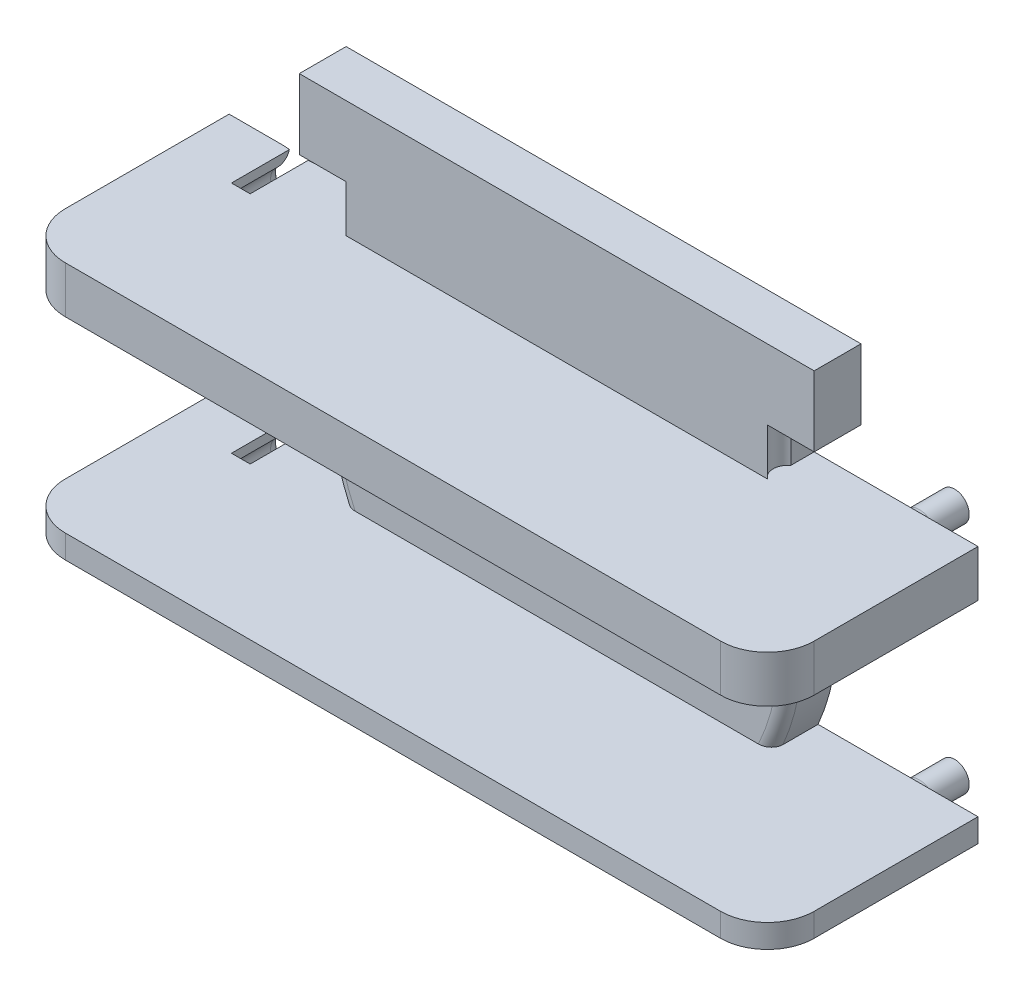
from build123d import *

# Parameters (mm, degrees)
BOSS_EXTRUDE1_DEPTH     = 2
SKETCH2_R               = 1.575
BOSS_EXTRUDE2_DEPTH     = 4
SKETCH3_R               = 1.8
BOSS_EXTRUDE3_DEPTH     = 0.75
SKETCH4_W               = 2
SKETCH4_H               = 17
BOSS_EXTRUDE4_DEPTH     = 0.001
SKETCH5_W               = 18
SKETCH5_H               = 2
BOSS_EXTRUDE5_DEPTH     = 0.001
SKETCH6_W               = 2.001
SKETCH6_H               = 2
BOSS_EXTRUDE6_DEPTH     = 5
BOSS_EXTRUDE7_DEPTH     = 0.001
CUT_EXTRUDE1_DEPTH      = 20.519323784
SKETCH9_W               = 2.937742252
SKETCH9_H               = 8
CUT_EXTRUDE2_DEPTH      = 0.001
CUT_EXTRUDE11_START     = -0.001
SKETCH21_R              = 9.75
SKETCH21_R_2            = 1.8
CUT_EXTRUDE11_DEPTH     = 0.001
SKETCH10_W              = 32
SKETCH10_H              = 2
BOSS_EXTRUDE8_DEPTH     = 7
FILLET1_R               = 0.5
SKETCH11_R              = 0.625
BOSS_EXTRUDE9_DEPTH     = 2
SKETCH14_W              = 2
SKETCH14_H              = 2
CUT_EXTRUDE5_DEPTH      = 22.401355237
SKETCH12_R              = 0.725
CUT_EXTRUDE3_DEPTH      = 2.5
CUT_EXTRUDE6_DEPTH      = 2
FILLET2_R               = 0.5
FILLET3_R               = 0.5
FILLET4_R               = 2
CUT_EXTRUDE7_DEPTH      = 26.019992106
CUT_EXTRUDE7_DEPTH_BACK = 1
CUT_EXTRUDE12_REACH     = 23.401


with BuildPart() as part:
    # Sketch1 → Boss-Extrude1 (new body)
    with BuildSketch(Plane.XY):
        Polygon((-11, 6), (-11, 11), (11, 11), (11, 6), (11, -6), (-11, -6), align=None)
    extrude(amount=BOSS_EXTRUDE1_DEPTH)

    # Sketch3 → Boss-Extrude3 (add)
    with BuildSketch(Plane(origin=(0, 0, 0), x_dir=(-1, 0, 0), z_dir=(0, 0, -1))):
        with Locations(Location((0, 0, 0), (0, 0, 180))):
            Circle(SKETCH3_R)
    extrude(amount=BOSS_EXTRUDE3_DEPTH)

    # Sketch4 → Boss-Extrude4 (add)
    with BuildSketch(Plane(origin=(0, 0, 0), x_dir=(-1, 0, 0), z_dir=(0, 0, -1))):
        with Locations((10, 2.5)):
            Rectangle(SKETCH4_W, SKETCH4_H)
        with Locations((-10, 2.5)):
            Rectangle(SKETCH4_W, SKETCH4_H)
    extrude(amount=BOSS_EXTRUDE4_DEPTH)

    # Sketch5 → Boss-Extrude5 (add)
    with BuildSketch(Plane(origin=(0, 0, 0), x_dir=(-1, 0, 0), z_dir=(0, 0, -1))):
        with Locations((0, 10)):
            Rectangle(SKETCH5_W, SKETCH5_H)
    extrude(amount=BOSS_EXTRUDE5_DEPTH)

    # Sketch6 → Boss-Extrude6 (add)
    with BuildSketch(Plane(origin=(11, 0, 0), x_dir=(0, 0, -1), z_dir=(1, 0, 0))):
        with Locations((-0.9995, -5)):
            Rectangle(SKETCH6_W, SKETCH6_H)
        with Locations((-0.9995, 5)):
            Rectangle(SKETCH6_W, SKETCH6_H)
    boss_extrude6 = extrude(amount=BOSS_EXTRUDE6_DEPTH)

    # Mirror1: Boss-Extrude6 across plane
    add(boss_extrude6.mirror(Plane(origin=(0, 0, 0), x_dir=(0, 0, 1), z_dir=(1, 0, 0))))

    # Sketch7 → Boss-Extrude7 (add)
    with BuildSketch(Plane(origin=(0, 0, -0.001), x_dir=(-1, 0, 0), z_dir=(0, 0, -1))):
        with BuildLine():
            ThreePointArc((-6.708203932, -6), (-8.407551231, -3.211398808), (-9, 0))
            Line((-9, 0), (-9, -6))
            Line((-9, -6), (-6.708203932, -6))
        make_face()
        with BuildLine():
            Line((-9, 9), (-9, 0))
            ThreePointArc((-9, 0), (-6.363961031, 6.363961031), (0, 9))
            Line((0, 9), (-9, 9))
        make_face()
    boss_extrude7 = extrude(amount=-BOSS_EXTRUDE7_DEPTH)

    # Sketch8 → Cut-Extrude1 (cut, through all)
    with BuildSketch(Plane(origin=(0, 0, -0.001), x_dir=(-1, 0, 0), z_dir=(0, 0, -1))):
        with BuildLine():
            Line((-11, 4), (-9.16515139, 4))
            ThreePointArc((-9.16515139, 4), (-10, 0), (-9.16515139, -4))
            Line((-9.16515139, -4), (-11, -4))
            Line((-11, -4), (-11, 4))
        make_face()
    cut_extrude1 = extrude(amount=-CUT_EXTRUDE1_DEPTH, mode=Mode.SUBTRACT)

    # Sketch9 → Cut-Extrude2 (cut)
    with BuildSketch(Plane(origin=(0, 0, -0.001), x_dir=(-1, 0, 0), z_dir=(0, 0, -1))):
        with Locations((-9.531128874, 0)):
            Rectangle(SKETCH9_W, SKETCH9_H)
    cut_extrude2 = extrude(amount=-CUT_EXTRUDE2_DEPTH, mode=Mode.SUBTRACT)

    # Mirror2: Boss-Extrude7, Cut-Extrude1, Cut-Extrude2 across plane
    add(boss_extrude7.mirror(Plane(origin=(0, 0, 0), x_dir=(0, 0, 1), z_dir=(1, 0, 0))))
    add(cut_extrude1.mirror(Plane(origin=(0, 0, 0), x_dir=(0, 0, 1), z_dir=(1, 0, 0))), mode=Mode.SUBTRACT)
    add(cut_extrude2.mirror(Plane(origin=(0, 0, 0), x_dir=(0, 0, 1), z_dir=(1, 0, 0))), mode=Mode.SUBTRACT)

    # Sketch21 → Cut-Extrude11 (cut)
    with BuildSketch(Plane(origin=(0, 0, -0.001), x_dir=(-1, 0, 0), z_dir=(0, 0, -1)).offset(CUT_EXTRUDE11_START)):
        Circle(SKETCH21_R)
        with Locations(Location((0, 0, 0), (0, 0, 180))):
            Circle(SKETCH21_R_2, mode=Mode.SUBTRACT)
    extrude(amount=CUT_EXTRUDE11_DEPTH, mode=Mode.SUBTRACT)

    # Sketch10 → Boss-Extrude8 (add)
    with BuildSketch(Plane.XY.offset(2)):
        with Locations((0, -5)):
            Rectangle(SKETCH10_W, SKETCH10_H)
        with Locations((0, 5)):
            Rectangle(SKETCH10_W, SKETCH10_H)
    extrude(amount=BOSS_EXTRUDE8_DEPTH)

    # Fillet1
    fillet1_edges = [part.edges().sort_by_distance(p)[0] for p in [
        (10, 0, 2),
        (-10, 0, 2),
    ]]
    fillet(fillet1_edges, radius=FILLET1_R)

    # Sketch11 → Boss-Extrude9 (add)
    with BuildSketch(Plane(origin=(0, 0, -0.001), x_dir=(-1, 0, 0), z_dir=(0, 0, -1))):
        with Locations(Location((-13, -5, 0), (0, 0, 180))):
            Circle(SKETCH11_R)
    boss_extrude9 = extrude(amount=BOSS_EXTRUDE9_DEPTH)

    # Sketch14 → Cut-Extrude5 (cut, through all)
    with BuildSketch(Plane(origin=(0, 0, -0.001), x_dir=(-1, 0, 0), z_dir=(0, 0, -1))):
        with Locations((10, 7)):
            Rectangle(SKETCH14_W, SKETCH14_H)
        with Locations((-10, 7)):
            Rectangle(SKETCH14_W, SKETCH14_H)
    extrude(amount=-CUT_EXTRUDE5_DEPTH, mode=Mode.SUBTRACT)

    # Sketch12 → Cut-Extrude3 (cut)
    with BuildSketch(Plane(origin=(0, 0, -0.001), x_dir=(-1, 0, 0), z_dir=(0, 0, -1))):
        with Locations((13, -5)):
            Circle(SKETCH12_R)
    cut_extrude3 = extrude(amount=-CUT_EXTRUDE3_DEPTH, mode=Mode.SUBTRACT)

    # Sketch16 → Cut-Extrude6 (cut)
    with BuildSketch(Plane(origin=(0, 6, 0), x_dir=(1, 0, 0), z_dir=(0, 1, 0))):
        with BuildLine():
            Line((-9, -1), (-9, -2))
            ThreePointArc((-9, -2), (-8.75, -1.5), (-9, -1))
        make_face()
    cut_extrude6 = extrude(amount=CUT_EXTRUDE6_DEPTH, mode=Mode.SUBTRACT)

    # Mirror3: Boss-Extrude9, Cut-Extrude3 across plane
    add(boss_extrude9.mirror(Plane.ZX))
    add(cut_extrude3.mirror(Plane.ZX), mode=Mode.SUBTRACT)

    # Mirror4: Cut-Extrude6 across plane
    add(cut_extrude6.mirror(Plane(origin=(0, 0, 0), x_dir=(0, 0, 1), z_dir=(1, 0, 0))), mode=Mode.SUBTRACT)

    # Fillet2
    fillet2_edges = [part.edges().sort_by_distance(p)[0] for p in [
        (12.375, -5, -0.001),
        (12.375, 5, -0.001),
    ]]
    fillet(fillet2_edges, radius=FILLET2_R)

    # Fillet3
    # the kernel refuses this fillet: 0.5 mm, written as the material it takes off along each edge
    with BuildSketch(Plane(origin=(-13, -5, -0.001), x_dir=(-1, 0, 0), z_dir=(0, -1, 0))) as fillet3_piece_1:
        with BuildLine():
            CenterArc((0.725 + FILLET3_R, -FILLET3_R), FILLET3_R, 90, 90)
            Line((0.725, -FILLET3_R), (0.725, 0))
            Line((0.725, 0), (0.725 + FILLET3_R, 0))
        make_face()
    revolve(axis=Axis((-13, -5, -0.001), (0, 0, -1)), mode=Mode.SUBTRACT)
    with BuildSketch(Plane(origin=(-13, 5, -0.001), x_dir=(-1, 0, 0), z_dir=(0, 1, 0))) as fillet3_piece_2:
        with BuildLine():
            CenterArc((0.725 + FILLET3_R, FILLET3_R), FILLET3_R, 180, 90)
            Line((0.725, FILLET3_R), (0.725, 0))
            Line((0.725, 0), (0.725 + FILLET3_R, 0))
        make_face()
    revolve(axis=Axis((-13, 5, -0.001), (0, 0, 1)), mode=Mode.SUBTRACT)

    # Fillet4
    fillet4_edges = [part.edges().sort_by_distance(p)[0] for p in [
        (16, -5, 9),
        (-16, -5, 9),
        (-16, 5, 9),
        (16, 5, 9),
    ]]
    fillet(fillet4_edges, radius=FILLET4_R)

    # Sketch17 → Cut-Extrude7 (cut, two sides: drawn at the far end of the back side and taken through both)
    with BuildSketch(Plane.XZ.offset(6).offset(-CUT_EXTRUDE7_DEPTH_BACK)):
        with BuildLine():
            Line((-16, 7), (-16, -0.001))
            Line((-16, -0.001), (-14.5, -0.001))
            Line((-14.5, -0.001), (-14.5, 7))
            ThreePointArc((-14.5, 7), (-14.353553391, 7.353553391), (-14, 7.5))
            Line((-14, 7.5), (14, 7.5))
            ThreePointArc((14, 7.5), (14.353553391, 7.353553391), (14.5, 7))
            Line((14.5, 7), (14.5, -0.001))
            Line((14.5, -0.001), (16, -0.001))
            Line((16, -0.001), (16, 7))
            ThreePointArc((16, 7), (15.414213562, 8.414213562), (14, 9))
            Line((14, 9), (-14, 9))
            ThreePointArc((-14, 9), (-15.414213562, 8.414213562), (-16, 7))
        make_face()
    extrude(amount=CUT_EXTRUDE7_DEPTH + CUT_EXTRUDE7_DEPTH_BACK, mode=Mode.SUBTRACT)


with BuildPart() as body_2:
    # Sketch2 → Boss-Extrude2 (new body)
    with BuildSketch(Plane(origin=(0, 0, 2), x_dir=(-1, 0, 0), z_dir=(0, 0, -1))):
        Circle(SKETCH2_R)
    extrude(amount=BOSS_EXTRUDE2_DEPTH)


with BuildPart() as part_1:
    add(part.part)

    # Combine2: cut body 2
    add(body_2.part, mode=Mode.SUBTRACT)

    # Cut-Extrude12: up to this face of the body (flat: up to its plane)
    cut_extrude12_end = Plane(part_1.part.faces().sort_by_distance((-13, -5, 2.499))[0])
    # Sketch23 → Cut-Extrude12 (cut, up to the picked face)
    with BuildSketch(Plane(origin=(0, 0, -0.001), x_dir=(-1, 0, 0), z_dir=(0, 0, -1)), mode=Mode.PRIVATE) as cut_extrude12_sk1:
        with BuildLine():
            Line((12.6, -6), (12.6, -4))
            ThreePointArc((12.6, -4), (13, -3.6), (13.4, -4))
            Line((13.4, -4), (13.4, -6))
            ThreePointArc((13.4, -6), (13, -6.4), (12.6, -6))
        make_face()
    cut_extrude12_tool1 = split(extrude(cut_extrude12_sk1.sketch, amount=-CUT_EXTRUDE12_REACH, mode=Mode.PRIVATE), bisect_by=cut_extrude12_end, keep=Keep.BOTH, mode=Mode.PRIVATE)
    cut_extrude12 = cut_extrude12_tool1.solids().sort_by(Axis((-13, -5, -0.001), (0, 0, 1)))[0]
    add(cut_extrude12, mode=Mode.SUBTRACT)

    # Mirror5: Cut-Extrude12 across plane
    add(cut_extrude12.mirror(Plane.ZX), mode=Mode.SUBTRACT)


solid = part_1.part
